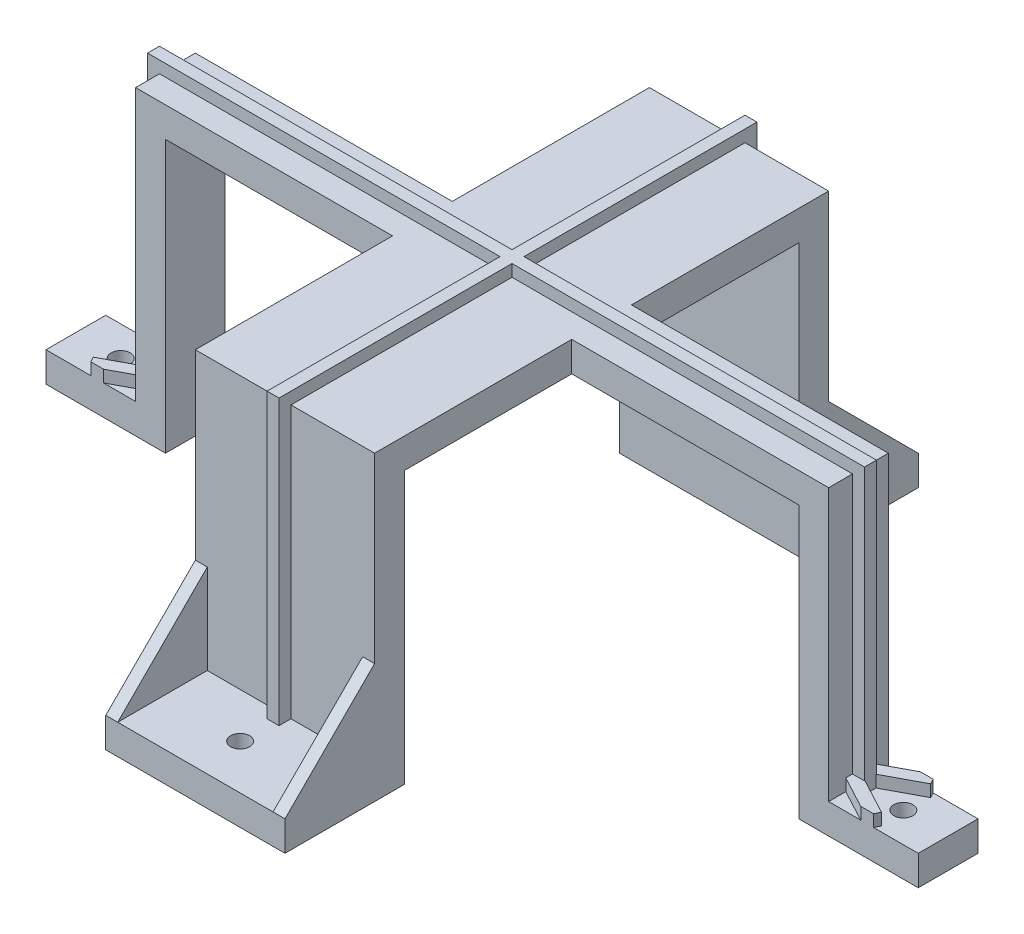
from build123d import *

# Parameters (mm, degrees)
BOSS_EXTRUDE1_DEPTH = 5
SKETCH2_W           = 5
SKETCH2_H           = 10
SKETCH2_W_2         = 30
SKETCH2_H_2         = 5
BOSS_EXTRUDE2_DEPTH = 45.5
SKETCH3_W           = 30
SKETCH3_H           = 15
SKETCH3_R           = 1.6
SKETCH3_W_2         = 15
SKETCH3_H_2         = 10
BOSS_EXTRUDE3_DEPTH = 5
SKETCH4_W           = 2
SKETCH4_H           = 76
SKETCH4_W_2         = 116
SKETCH4_H_2         = 2
EXTRUDE_THIN1_DEPTH = 2
SKETCH5_W           = 2
SKETCH5_H           = 47.5
EXTRUDE_THIN2_DEPTH = 2
SKETCH6_W           = 2
SKETCH6_H           = 47.5
EXTRUDE_THIN3_DEPTH = 2
SKETCH7_W           = 2
SKETCH7_H           = 47.5
EXTRUDE_THIN4_DEPTH = 2
SKETCH8_W           = 2
SKETCH8_H           = 47.5
EXTRUDE_THIN5_DEPTH = 2
RIB2_REACH          = 116.797
SKETCH9_WALL_W      = 252.8063218
SKETCH9_WALL_H      = 2
RIB3_START          = -2
RIB3_DEPTH          = 2
RIB5_REACH          = 116.797
SKETCH11_WALL_W     = 252.8063218
SKETCH11_WALL_H     = 2
RIB6_START          = -2
RIB6_DEPTH          = 2
EXTRUDE_THIN6_DEPTH = 2
SKETCH16_W          = 3.138831492
SKETCH16_H          = 8.051178831
SKETCH16_W_2        = 2.588504754
SKETCH16_H_2        = 9.327196591
CUT_EXTRUDE1_DEPTH  = 164.555036608


# Read off the part's stored shape, not the designer's step: Boss-Extrude1, Rib3, Rib6
with BuildPart() as part:
    # Boss-Extrude1 outline → Boss-Extrude1 (new body)
    with BuildSketch(Plane(origin=(0, 0, 0), x_dir=(1, 0, 0), z_dir=(0, 1, 0))):
        Polygon((19.060732093, 33), (-10.939267907, 33), (-10.939267907, 0), (-53.939267907, 0), (-53.939267907, -10), (-10.939267907, -10), (-10.939267907, -43), (19.060732093, -43), (19.060732093, -10), (62.060732093, -10), (62.060732093, 0), (19.060732093, 0), align=None)
    extrude(amount=BOSS_EXTRUDE1_DEPTH)

    # Sketch2 → Boss-Extrude2 (add)
    with BuildSketch(Plane.XZ):
        with Locations((-51.439267907, 5)):
            Rectangle(SKETCH2_W, SKETCH2_H)
        with Locations((4.060732093, 40.5)):
            Rectangle(SKETCH2_W_2, SKETCH2_H_2)
        with Locations((4.060732093, -30.5)):
            Rectangle(SKETCH2_W_2, SKETCH2_H_2)
        with Locations((59.560732093, 5)):
            Rectangle(SKETCH2_W, SKETCH2_H)
    extrude(amount=BOSS_EXTRUDE2_DEPTH)

    # Sketch3 → Boss-Extrude3 (add)
    # profile 1 of 4: a face of its own
    with BuildSketch(Plane.XZ.offset(45.5)):
        with Locations((4.060732093, 50.5)):
            Rectangle(SKETCH3_W, SKETCH3_H)
        with Locations(Location((4.060732093, 50.5, 0), (0, 0, 270))):
            Circle(SKETCH3_R, mode=Mode.SUBTRACT)
    # profile 2 of 4: a face of its own
    with BuildSketch(Plane.XZ.offset(45.5)):
        with Locations((69.560732093, 5)):
            Rectangle(SKETCH3_W_2, SKETCH3_H_2)
        with Locations(Location((69.560732093, 5, 0), (0, 0, 270))):
            Circle(SKETCH3_R, mode=Mode.SUBTRACT)
    # profile 3 of 4: a face of its own
    with BuildSketch(Plane.XZ.offset(45.5)):
        with Locations((4.060732093, -40.5)):
            Rectangle(SKETCH3_W, SKETCH3_H)
        with Locations(Location((4.060732093, -40.5, 0), (0, 0, 270))):
            Circle(SKETCH3_R, mode=Mode.SUBTRACT)
    # profile 4 of 4: a face of its own
    with BuildSketch(Plane.XZ.offset(45.5)):
        with Locations((-61.439267907, 5)):
            Rectangle(SKETCH3_W_2, SKETCH3_H_2)
        with Locations(Location((-61.439267907, 5, 0), (0, 0, 270))):
            Circle(SKETCH3_R, mode=Mode.SUBTRACT)
    extrude(amount=-BOSS_EXTRUDE3_DEPTH)

    # Sketch4 → Extrude-Thin1 (add)
    with BuildSketch(Plane(origin=(0, 5, 0), x_dir=(1, 0, 0), z_dir=(0, 1, 0))):
        with Locations((4.060732093, -5)):
            Rectangle(SKETCH4_W, SKETCH4_H)
        with Locations((4.060732093, -5)):
            Rectangle(SKETCH4_W_2, SKETCH4_H_2)
    extrude(amount=EXTRUDE_THIN1_DEPTH)

    # Sketch5 → Extrude-Thin2 (add)
    with BuildSketch(Plane.ZY.offset(53.939267907)):
        with Locations((5, -16.75)):
            Rectangle(SKETCH5_W, SKETCH5_H)
    extrude(amount=EXTRUDE_THIN2_DEPTH)

    # Sketch6 → Extrude-Thin3 (add)
    with BuildSketch(Plane(origin=(62.060732093, 0, 0), x_dir=(0, 0, -1), z_dir=(1, 0, 0))):
        with Locations((-5, -16.75)):
            Rectangle(SKETCH6_W, SKETCH6_H)
    extrude(amount=EXTRUDE_THIN3_DEPTH)

    # Sketch7 → Extrude-Thin4 (add)
    with BuildSketch(Plane.XY.offset(43)):
        with Locations((4.060732093, -16.75)):
            Rectangle(SKETCH7_W, SKETCH7_H)
    extrude(amount=EXTRUDE_THIN4_DEPTH)

    # Sketch8 → Extrude-Thin5 (add)
    with BuildSketch(Plane(origin=(0, 0, -33), x_dir=(-1, 0, 0), z_dir=(0, 0, -1))):
        with Locations((-4.060732093, -16.75)):
            Rectangle(SKETCH8_W, SKETCH8_H)
    extrude(amount=EXTRUDE_THIN5_DEPTH)

    # Sketch9 wall → Rib2 (add, up to next)
    with BuildSketch(Plane(origin=(-10.939267907, -33, 50.5), x_dir=(0, 0.707106781187, -0.707106781187), z_dir=(0, -0.707106781187, -0.707106781187)), mode=Mode.PRIVATE) as rib2_sk1:
        with Locations((0, 1)):
            Rectangle(SKETCH9_WALL_W, SKETCH9_WALL_H)
    rib2_tool1 = extrude(rib2_sk1.sketch, amount=RIB2_REACH, mode=Mode.PRIVATE) - part.part
    add(rib2_tool1.solids().sort_by_distance((-10.939267907, -33, 50.5))[0])

    # Rib3 outline → Rib3 (add)
    with BuildSketch(Plane(origin=(19.060732093, 0, 0), x_dir=(0, 0, -1), z_dir=(1, 0, 0)).offset(RIB3_START)):
        Polygon((-43, -25.5), (-58, -40.5), (-43, -40.5), align=None)
    extrude(amount=RIB3_DEPTH)

    # Sketch11 wall → Rib5 (add, up to next)
    with BuildSketch(Plane(origin=(19.060732093, -33, -40.5), x_dir=(0, 0.707106781187, 0.707106781187), z_dir=(0, -0.707106781187, 0.707106781187)), mode=Mode.PRIVATE) as rib5_sk1:
        with Locations((0, 1)):
            Rectangle(SKETCH11_WALL_W, SKETCH11_WALL_H)
    rib5_tool1 = extrude(rib5_sk1.sketch, amount=RIB5_REACH, mode=Mode.PRIVATE) - part.part
    add(rib5_tool1.solids().sort_by_distance((19.060732093, -33, -40.5))[0])

    # Rib6 outline → Rib6 (add)
    with BuildSketch(Plane.ZY.offset(10.939267907).offset(RIB6_START)):
        Polygon((-33, -25.5), (-48, -40.5), (-33, -40.5), align=None)
    extrude(amount=RIB6_DEPTH)

    # Sketch15 → Extrude-Thin6 (add)
    with BuildSketch(Plane(origin=(0, -40.5, 0), x_dir=(1, 0, 0), z_dir=(0, 1, 0))):
        Polygon((-53.468679672, -3.117647059), (-60.968679672, 0.882352941), (-61.909856142, -0.882352941), (-54.409856142, -4.882352941), align=None)
        Polygon((-54.409856142, -5.117647059), (-61.909856142, -9.117647059), (-60.968679672, -10.882352941), (-53.468679672, -6.882352941), align=None)
        Polygon((62.531320328, -4.882352941), (70.031320328, -0.882352941), (69.090143858, 0.882352941), (61.590143858, -3.117647059), align=None)
        Polygon((61.590143858, -6.882352941), (69.090143858, -10.882352941), (70.031320328, -9.117647059), (62.531320328, -5.117647059), align=None)
    extrude(amount=EXTRUDE_THIN6_DEPTH)

    # Sketch16 → Cut-Extrude1 (cut, through all)
    with BuildSketch(Plane(origin=(77.060732093, 0, 0), x_dir=(0, 0, -1), z_dir=(1, 0, 0))):
        with Locations((-11.569415746, -41.474410585)):
            Rectangle(SKETCH16_W, SKETCH16_H)
        with Locations((1.294252377, -40.836401705)):
            Rectangle(SKETCH16_W_2, SKETCH16_H_2)
    extrude(amount=-CUT_EXTRUDE1_DEPTH, mode=Mode.SUBTRACT)


solid = part.part
